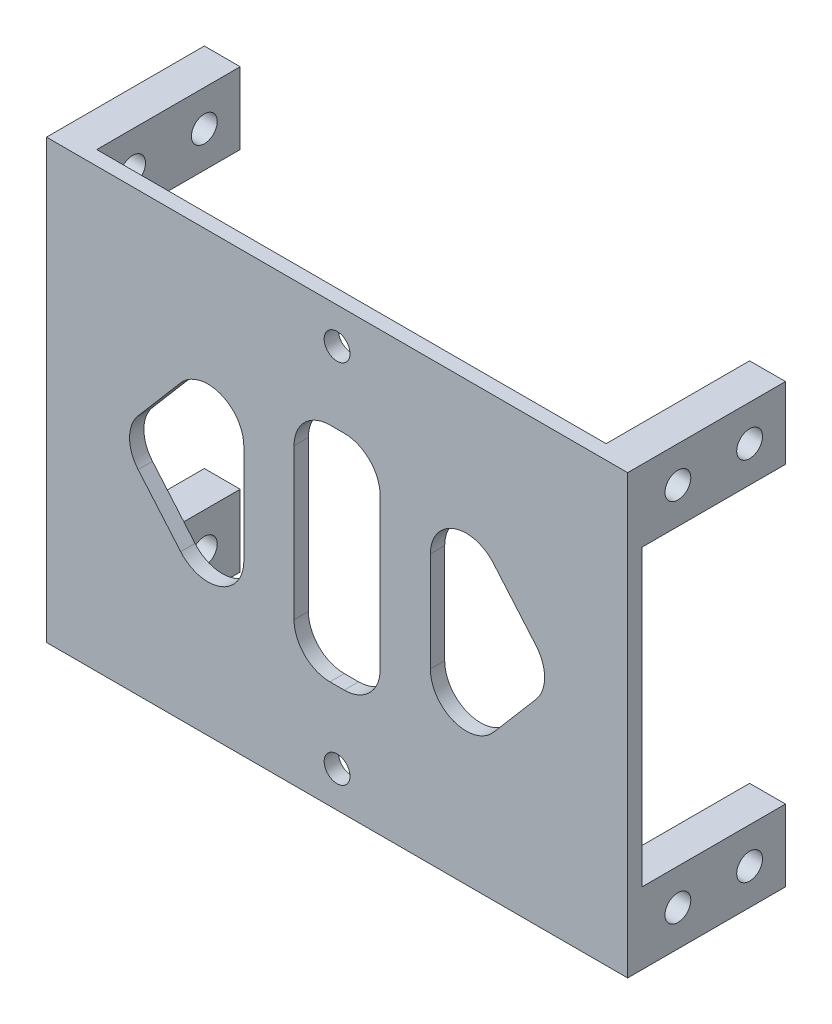
from build123d import *

# Parameters (mm, degrees)
ESQUISSE1_W             = 81
ESQUISSE1_H             = 61
ESQUISSE1_R             = 1.8
ESQUISSE1_W_2           = 12
ESQUISSE1_H_2           = 31
BOSS_EXTRU_1_DEPTH      = 2
ESQUISSE2_W             = 5
ESQUISSE2_H             = 10
BOSS_EXTRU_2_DEPTH      = 20
ESQUISSE3_R             = 1.8
ENL_V_MAT_EXTRU_1_DEPTH = 104.353761422
CONG_2_R                = 5


with BuildPart() as part:
    # Esquisse1 → Boss.-Extru.1 (new body)
    with BuildSketch(Plane.XY):
        with Locations((40.5, 30.5)):
            Rectangle(ESQUISSE1_W, ESQUISSE1_H)
        with Locations((40.5, 56)):
            Circle(ESQUISSE1_R, mode=Mode.SUBTRACT)
        with Locations((40.5, 5)):
            Circle(ESQUISSE1_R, mode=Mode.SUBTRACT)
        Polygon((10, 30.5), (27.5, 51), (27.5, 10), align=None, mode=Mode.SUBTRACT)
        Polygon((53.5, 51), (53.5, 10), (71, 30.5), align=None, mode=Mode.SUBTRACT)
        with Locations((40.5, 30.5)):
            Rectangle(ESQUISSE1_W_2, ESQUISSE1_H_2, mode=Mode.SUBTRACT)
    extrude(amount=BOSS_EXTRU_1_DEPTH)

    # Esquisse2 → Boss.-Extru.2 (add)
    with BuildSketch(Plane(origin=(0, 0, 0), x_dir=(-1, 0, 0), z_dir=(0, 0, -1))):
        with Locations((-78.5, 56)):
            Rectangle(ESQUISSE2_W, ESQUISSE2_H)
        with Locations((-78.5, 5)):
            Rectangle(ESQUISSE2_W, ESQUISSE2_H)
        with Locations((-2.5, 56)):
            Rectangle(ESQUISSE2_W, ESQUISSE2_H)
        with Locations((-2.5, 5)):
            Rectangle(ESQUISSE2_W, ESQUISSE2_H)
    extrude(amount=BOSS_EXTRU_2_DEPTH)

    # Esquisse3 → Enlèv. mat.-Extru.1 (cut, through all)
    with BuildSketch(Plane.ZY):
        with Locations((-15, 56)):
            Circle(ESQUISSE3_R)
        with Locations((-5, 56)):
            Circle(ESQUISSE3_R)
        with Locations((-15, 5)):
            Circle(ESQUISSE3_R)
        with Locations((-5, 5)):
            Circle(ESQUISSE3_R)
    extrude(amount=-ENL_V_MAT_EXTRU_1_DEPTH, mode=Mode.SUBTRACT)

    # Congé2
    cong_2_edges = [part.edges().sort_by_distance(p)[0] for p in [
        (71, 30.5, 1),
        (46.5, 15, 1),
        (27.5, 10, 1),
        (34.5, 15, 1),
        (53.5, 10, 1),
        (53.5, 51, 1),
        (34.5, 46, 1),
        (46.5, 46, 1),
        (27.5, 51, 1),
        (10, 30.5, 1),
    ]]
    fillet(cong_2_edges, radius=CONG_2_R)


solid = part.part
